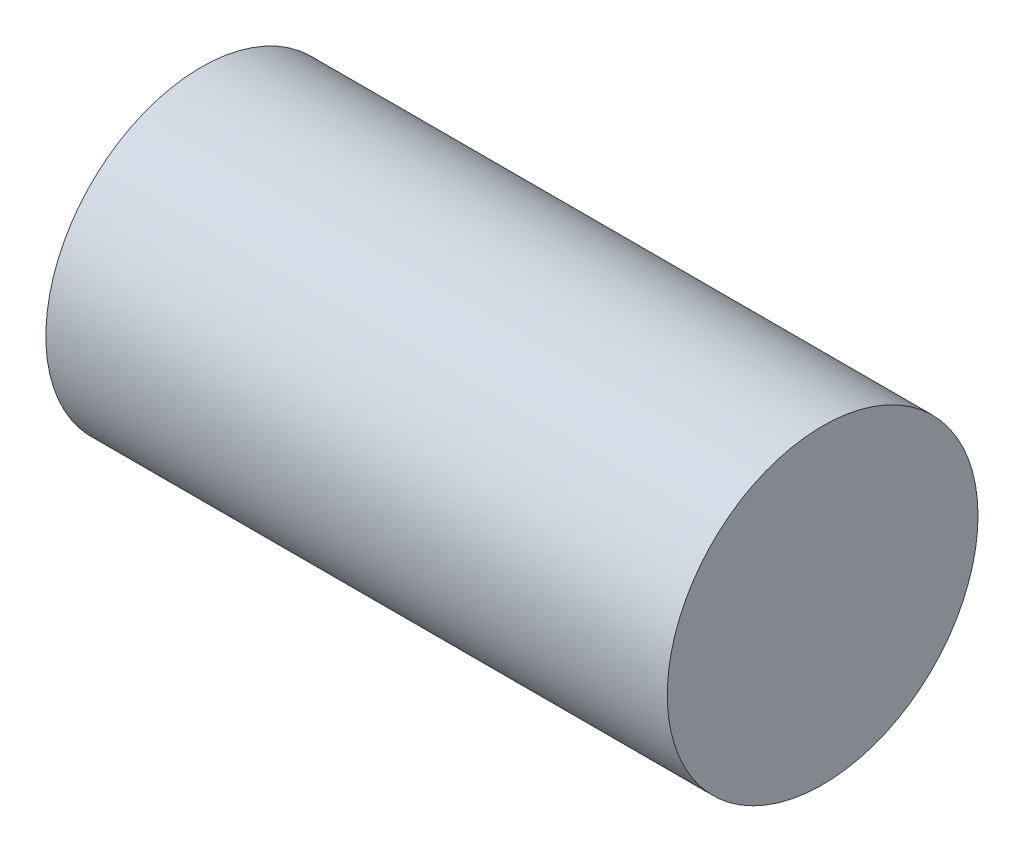
from build123d import *

# Parameters (mm, degrees)
BOSS_EXTRUDE1_DEPTH      = 10
BOSS_EXTRUDE1_DEPTH_BACK = 10
SKETCH1_R                = 5


with BuildPart() as part:
    # Sketch1 → Boss-Extrude1 (new, two sides: drawn at the far end of the back side and taken through both)
    with BuildSketch(Plane(origin=(0, 0, 0), x_dir=(0, 0, -1), z_dir=(1, 0, 0)).offset(-BOSS_EXTRUDE1_DEPTH_BACK)):
        Circle(SKETCH1_R)
    extrude(amount=BOSS_EXTRUDE1_DEPTH + BOSS_EXTRUDE1_DEPTH_BACK)


solid = part.part
